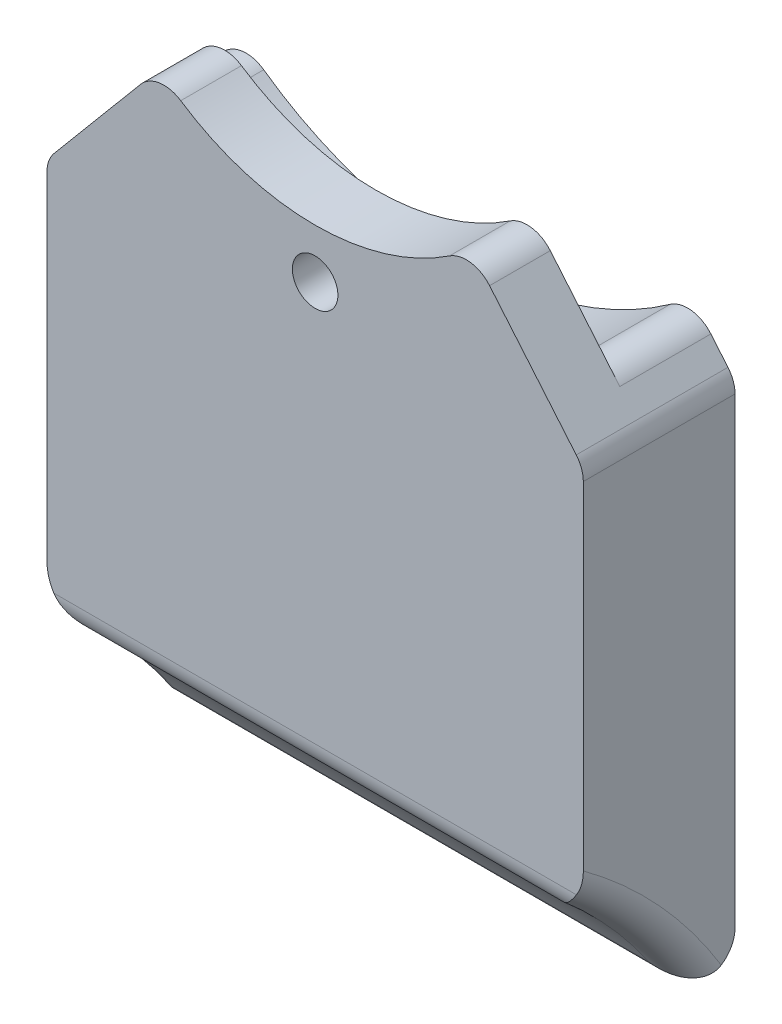
from build123d import *

# Parameters (mm, degrees)
SKETCH_1_R          = 1.5
EXTRUDE_1_DEPTH     = 4
EXTRUDE_START       = -10
EXTRUDE_2_DEPTH     = 10
EXTRUDE_3_DEPTH     = 10
CUT_EXTRUDE_1_DEPTH = 80.60065996608486
FILLET_1_R          = 2


with BuildPart() as part:
    # 草图1 → 凸台-拉伸1 (new body)
    with BuildSketch(Plane.XY):
        with BuildLine():
            ThreePointArc((10.284601754984648, -12.256711089903634), (1.78e-15, -16), (-10.284601754984646, -12.256711089903636))
            Line((-10.284601754984646, -12.25671108990364), (-14.848393783759084, -17.69562663604838))
            ThreePointArc((-14.848393783759082, -17.695626636048377), (1.78e-15, -23.10000000000001), (14.848393783759082, -17.695626636048374))
            Line((14.848393783759088, -17.695626636048377), (10.28460175498465, -12.256711089903638))
        make_face()
        with Locations((-1.05e-15, -19.25)):
            Circle(SKETCH_1_R, mode=Mode.SUBTRACT)
    extrude(amount=EXTRUDE_1_DEPTH)

    # 草图3 → 凸台-拉伸2 (add)
    with BuildSketch(Plane.XY.offset(4).offset(EXTRUDE_START)):
        with BuildLine():
            ThreePointArc((14.848393783759091, -17.695626636048377), (3.55e-15, -23.100000000000012), (-14.848393783759086, -17.69562663604838))
            Line((-14.848393783759084, -17.69562663604838), (-17.676659266379858, -21.066222185771874))
            ThreePointArc((-17.676659266379858, -21.066222185771878), (-5.05e-15, -27.5), (17.676659266379847, -21.066222185771885))
            Line((17.67665926637986, -21.066222185771874), (14.84839378375909, -17.695626636048377))
        make_face()
    extrude(amount=EXTRUDE_2_DEPTH)

    # 草图4 → 凸台-拉伸3 (add)
    with BuildSketch(Plane.XY.offset(4).offset(EXTRUDE_START)):
        with BuildLine():
            ThreePointArc((17.676659266379865, -21.066222185771874), (5.33e-15, -27.500000000000004), (-17.67665926637986, -21.06622218577188))
            Line((-17.676659266379858, -21.066222185771878), (-17.67665926637985, -71.06622218577188))
            Line((-17.67665926637985, -71.06622218577188), (17.676659266379865, -71.06622218577188))
            Line((17.67665926637986, -71.06622218577188), (17.67665926637986, -21.066222185771878))
        make_face()
    extrude(amount=EXTRUDE_3_DEPTH)

    # 草图7 → 切除-拉伸1 (cut, through all)
    with BuildSketch(Plane(origin=(17.67665926637986, 0, 0), x_dir=(0, 0, -1), z_dir=(1, 0, 0))):
        with BuildLine():
            ThreePointArc((5.9999999999999964, -60.303294673632124), (1.9053758185850107, -52.76773244798149), (-4, -46.54863430717742))
            Line((-4, -46.54863430717742), (-4, -71.06622218577188))
            Line((-4, -71.06622218577188), (6, -71.06622218577188))
            Line((6, -71.06622218577188), (6, -60.303294673632124))
        make_face()
    extrude(amount=-CUT_EXTRUDE_1_DEPTH, mode=Mode.SUBTRACT)

    # 圆角1
    fillet_1_edges = [part.edges().sort_by_distance(p)[0] for p in [
        (14.848393783759091, -17.69562663604838, -3),
        (-14.848393783759086, -17.69562663604838, -3),
        (-17.676659266379858, -21.066222185771878, -1),
        (10.28460175498465, -12.256711089903636, 2),
        (17.676659266379858, -21.066222185771885, -1),
        (-10.284601754984646, -12.25671108990364, 2),
        (3.55e-15, -60.303294673632124, -5.999999999999998),
        (-17.676659266379854, -52.76773244798149, -1.9053758185850072),
        (3.55e-15, -46.54863430717742, 4),
        (17.67665926637986, -52.76773244798149, -1.9053758185850072),
    ]]
    fillet(fillet_1_edges, radius=FILLET_1_R)


solid = part.part
